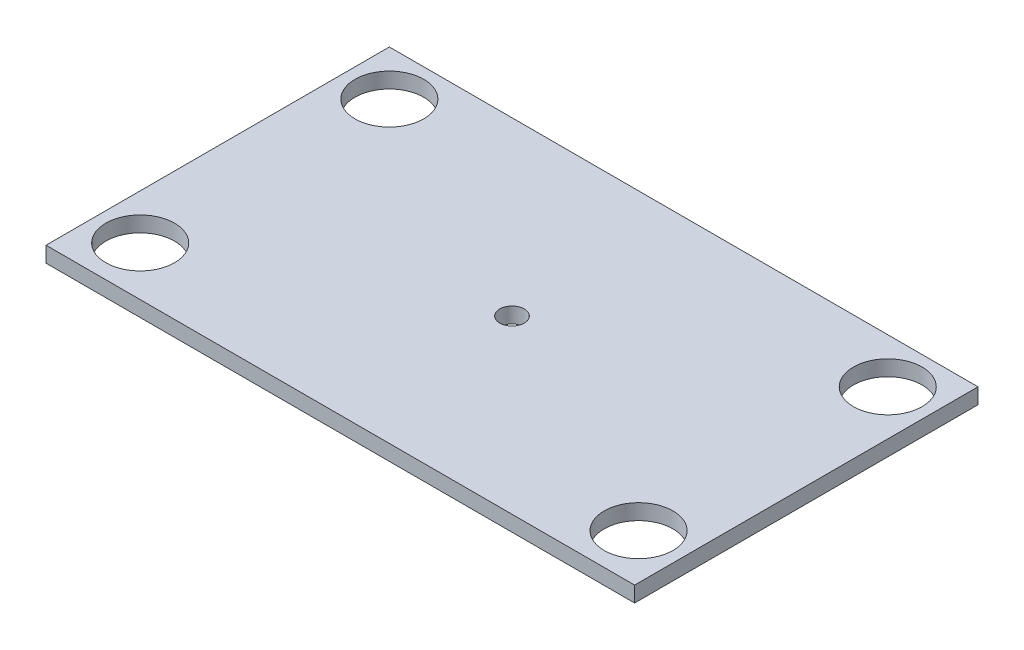
from build123d import *

# Parameters (mm, degrees)
SKETCH1_W           = 60
SKETCH1_H           = 35
SKETCH1_R           = 3.5
SKETCH1_R_2         = 1.25
BOSS_EXTRUDE1_DEPTH = 1.5875


with BuildPart() as part:
    # Sketch1 → Boss-Extrude1 (new body)
    with BuildSketch(Plane(origin=(0, 0, 0), x_dir=(1, 0, 0), z_dir=(0, 1, 0))):
        with Locations((30, 17.5)):
            Rectangle(SKETCH1_W, SKETCH1_H)
        with Locations((4.6, 30.4)):
            Circle(SKETCH1_R, mode=Mode.SUBTRACT)
        with Locations((55.4, 30.4)):
            Circle(SKETCH1_R, mode=Mode.SUBTRACT)
        with Locations((4.6, 5)):
            Circle(SKETCH1_R, mode=Mode.SUBTRACT)
        with Locations((55.4, 5)):
            Circle(SKETCH1_R, mode=Mode.SUBTRACT)
        with Locations((30, 17.5)):
            Circle(SKETCH1_R_2, mode=Mode.SUBTRACT)
    extrude(amount=BOSS_EXTRUDE1_DEPTH)


solid = part.part
